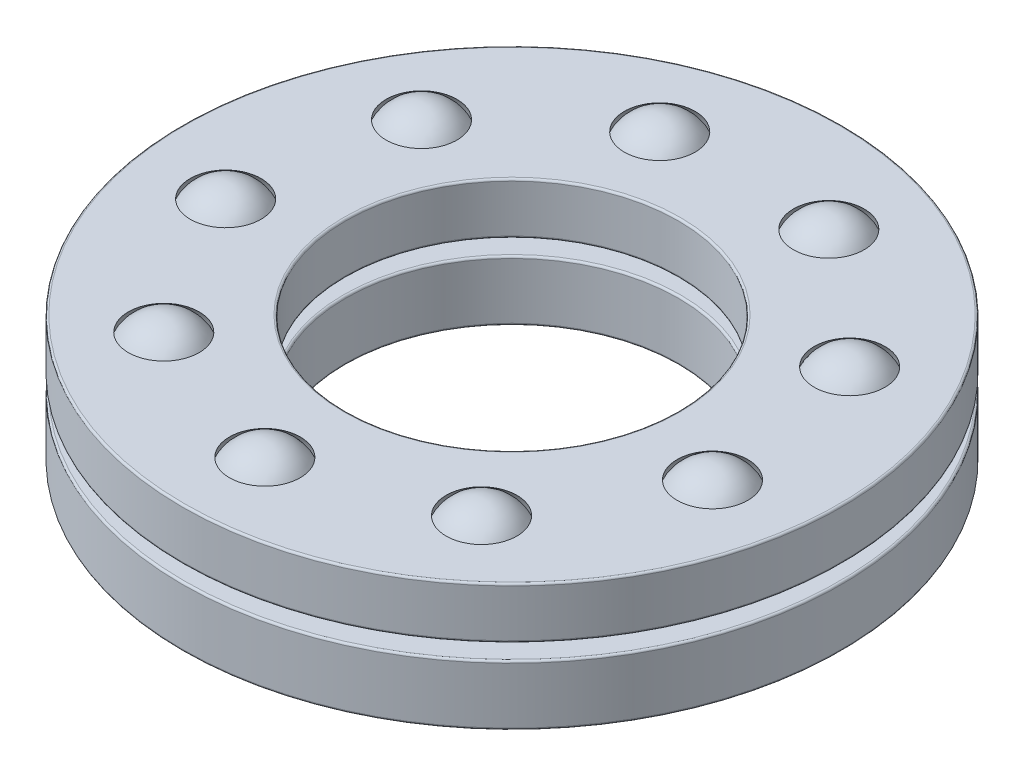
from build123d import *

# Parameters (mm, degrees)
SKETCH1_W         = 3.962
SKETCH1_H         = 1.25
CIRPATTERN1_COUNT = 9
CIRPATTERN1_ANGLE = 320
CIRPATTERN2_COUNT = 9
SKETCH4_W         = 3.962
SKETCH4_H         = 1.46
FILLET1_R         = 0.0492
FILLET2_R         = 0.0492
FILLET3_R         = 0.0492


# Read off the part's stored shape, not the designer's step: Body-Delete/Keep 1
with BuildPart() as part:
    # Sketch1 → Revolve1 (revolve)
    with BuildSketch(Plane(origin=(0, 0, 0), x_dir=(0, 0, -1), z_dir=(1, 0, 0)), mode=Mode.PRIVATE) as revolve1_sk:
        with Locations((-6.019, 0)):
            Rectangle(SKETCH1_W, SKETCH1_H)
    revolve(revolve1_sk.sketch.rotate(Axis((0, -2.46, 0), (0, 1, 0)), 180), axis=Axis((0, -2.46, 0), (0, 1, 0)))

    # Sketch3 → Cut-Revolve1 (revolve, cut)
    with BuildSketch(Plane(origin=(0, 0, 0), x_dir=(0, 0, -1), z_dir=(1, 0, 0))):
        with BuildLine():
            Line((-6, 1.0625), (-6, -1.0625))
            ThreePointArc((-6, -1.0625), (-7.0625, 0), (-6, 1.0625))
        make_face()
    cut_revolve1 = revolve(axis=Axis((0, 1.0625, 6), (0, -1, 0)), mode=Mode.SUBTRACT)

    # CirPattern2: Cut-Revolve1 ×9 about axis
    cirpattern2_axis = Axis((0, 0, 0), (0, 1, 0))
    for i in range(1, CIRPATTERN2_COUNT):
        add(cut_revolve1.rotate(cirpattern2_axis, i * 360 / CIRPATTERN2_COUNT), mode=Mode.SUBTRACT)

    # Fillet2
    fillet2_edges = [part.edges().sort_by_distance(p)[0] for p in [
        (0, 0.625, 8),
        (0, 0.625, 4.038),
        (0, -0.625, 4.038),
        (0, -0.625, 8),
    ]]
    fillet(fillet2_edges, radius=FILLET2_R)


with BuildPart() as body_2:
    # Sketch2 → Revolve2 (revolve)
    with BuildSketch(Plane(origin=(0, 0, 0), x_dir=(0, 0, -1), z_dir=(1, 0, 0))):
        with BuildLine():
            Line((-6, 1), (-6, -1))
            ThreePointArc((-6, -1), (-7, 0), (-6, 1))
        make_face()
    revolve(axis=Axis((0, 1, 6), (0, -1, 0)))


with BuildPart() as cirpattern1_1:
    # CirPattern1: pattern copy
    add(body_2.part.rotate(Axis((0, 2.46, 0), (0, -1, 0)), 1 * CIRPATTERN1_ANGLE / (CIRPATTERN1_COUNT - 1)))


with BuildPart() as cirpattern1_2:
    # CirPattern1: pattern copy
    add(body_2.part.rotate(Axis((0, 2.46, 0), (0, -1, 0)), 2 * CIRPATTERN1_ANGLE / (CIRPATTERN1_COUNT - 1)))


with BuildPart() as cirpattern1_3:
    # CirPattern1: pattern copy
    add(body_2.part.rotate(Axis((0, 2.46, 0), (0, -1, 0)), 3 * CIRPATTERN1_ANGLE / (CIRPATTERN1_COUNT - 1)))


with BuildPart() as cirpattern1_4:
    # CirPattern1: pattern copy
    add(body_2.part.rotate(Axis((0, 2.46, 0), (0, -1, 0)), 4 * CIRPATTERN1_ANGLE / (CIRPATTERN1_COUNT - 1)))


with BuildPart() as cirpattern1_5:
    # CirPattern1: pattern copy
    add(body_2.part.rotate(Axis((0, 2.46, 0), (0, -1, 0)), 5 * CIRPATTERN1_ANGLE / (CIRPATTERN1_COUNT - 1)))


with BuildPart() as cirpattern1_6:
    # CirPattern1: pattern copy
    add(body_2.part.rotate(Axis((0, 2.46, 0), (0, -1, 0)), 6 * CIRPATTERN1_ANGLE / (CIRPATTERN1_COUNT - 1)))


with BuildPart() as cirpattern1_7:
    # CirPattern1: pattern copy
    add(body_2.part.rotate(Axis((0, 2.46, 0), (0, -1, 0)), 7 * CIRPATTERN1_ANGLE / (CIRPATTERN1_COUNT - 1)))


with BuildPart() as cirpattern1_8:
    # CirPattern1: pattern copy
    add(body_2.part.rotate(Axis((0, 2.46, 0), (0, -1, 0)), 8 * CIRPATTERN1_ANGLE / (CIRPATTERN1_COUNT - 1)))


with BuildPart() as body_11:
    # Sketch4 → Revolve3 (revolve)
    with BuildSketch(Plane(origin=(0, 0, 0), x_dir=(0, 0, -1), z_dir=(1, 0, 0)), mode=Mode.PRIVATE) as revolve3_sk:
        with Locations((-6.019, 1.73)):
            Rectangle(SKETCH4_W, SKETCH4_H)
        with Locations((-6.019, -1.73)):
            Rectangle(SKETCH4_W, SKETCH4_H)
    revolve(revolve3_sk.sketch.rotate(Axis((0, -2.46, 0), (0, 1, 0)), 180), axis=Axis((0, -2.46, 0), (0, 1, 0)))

    # Fillet1
    fillet1_edges = [body_11.edges().sort_by_distance(p)[0] for p in [
        (0, 1, 8),
        (0, 1, 4.038),
        (0, 2.46, 4.038),
        (0, 2.46, 8),
    ]]
    fillet(fillet1_edges, radius=FILLET1_R)

    # Fillet3
    fillet3_edges = [body_11.edges().sort_by_distance(p)[0] for p in [
        (0, -2.46, 8),
        (0, -2.46, 4.038),
        (0, -1, 4.038),
        (0, -1, 8),
    ]]
    fillet(fillet3_edges, radius=FILLET3_R)

    # Body-Delete/Keep 1 outline → Body-Delete/Keep 1 (revolve, cut)
    with BuildSketch(Plane.XY):
        with BuildLine():
            Line((8, 1.0492), (8, 2.4108))
            ThreePointArc((8, 2.4108), (7.985589654, 2.445589654), (7.9508, 2.46))
            Line((7.9508, 2.46), (4.0872, 2.46))
            ThreePointArc((4.0872, 2.46), (4.052410346, 2.445589654), (4.038, 2.4108))
            Line((4.038, 2.4108), (4.038, 1.0492))
            ThreePointArc((4.038, 1.0492), (4.052410346, 1.014410346), (4.0872, 1))
            Line((4.0872, 1), (7.9508, 1))
            ThreePointArc((7.9508, 1), (7.985589654, 1.014410346), (8, 1.0492))
        make_face()
    revolve(axis=Axis((0, 0, 0), (0, 1, 0)), mode=Mode.SUBTRACT)


solid = Compound([part.part, body_2.part, cirpattern1_1.part, cirpattern1_2.part, cirpattern1_3.part, cirpattern1_4.part, cirpattern1_5.part, cirpattern1_6.part, cirpattern1_7.part, cirpattern1_8.part, body_11.part])
